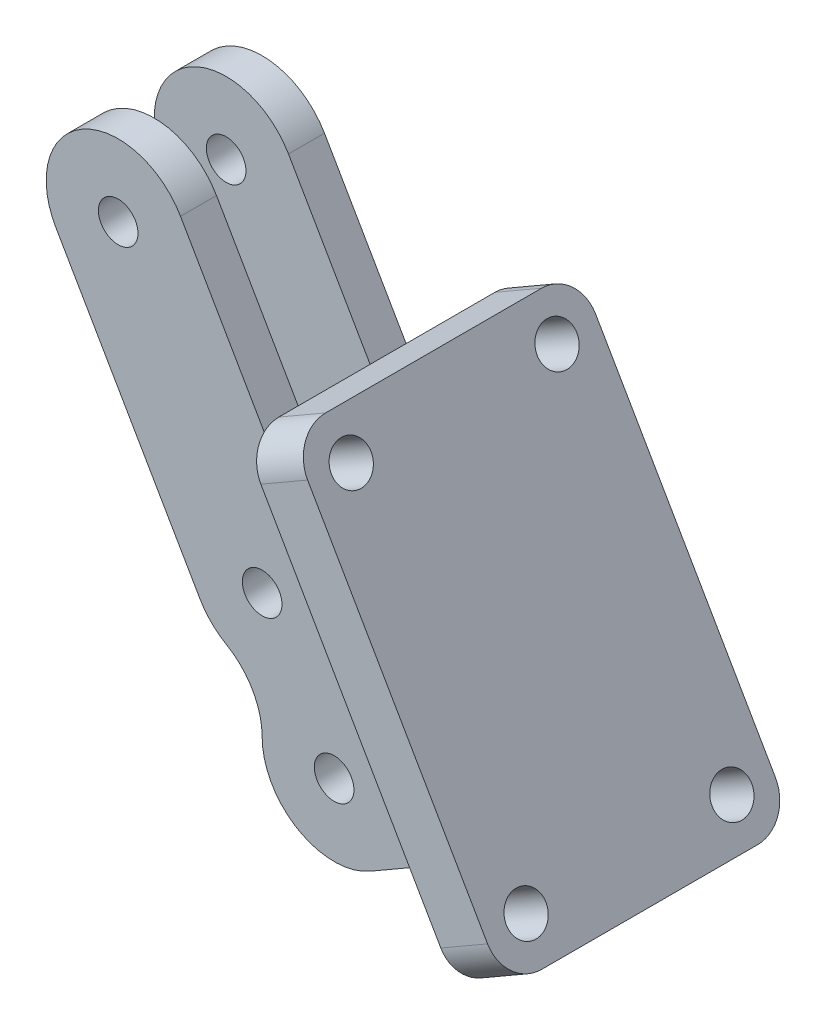
from build123d import *

# Parameters (mm, degrees)
SKETCH7_R               = 2.75
BOSS_EXTRUDE5_DEPTH     = 5
FILLET4_R               = 10
SKETCH8_R               = 2.75
BOSS_EXTRUDE6_DEPTH     = 5
SKETCH9_W               = 10
SKETCH9_H               = 10
SKETCH9_H_2             = 40
SKETCH9_W_2             = 5
BOSS_EXTRUDE7_DEPTH     = 7.5
FILLET5_R               = 5
SKETCH10_R              = 2.75
CUT_EXTRUDE3_DEPTH      = 64.495460213
SKETCH11_R              = 2.75
BOSS_EXTRUDE8_DEPTH     = 5
BOSS_EXTRUDE9_DEPTH     = 5
FILLET6_R               = 5
CUT_EXTRUDE4_START      = -5
SKETCH13_R              = 2.75
CUT_EXTRUDE4_DEPTH      = 5
CUT_EXTRUDE5_DEPTH      = 127.477470595
CUT_EXTRUDE5_DEPTH_BACK = 127.477470595
SKETCH14_R              = 2.75


with BuildPart() as part:
    # Sketch7 → Boss-Extrude5 (new body)
    with BuildSketch(Plane.XY):
        with BuildLine():
            Line((72.320508076, 39.737205584), (55, 29.737205584))
            ThreePointArc((55, 29.737205584), (51.339745962, 16.076951546), (65, 12.416697508))
            ThreePointArc((65, 12.416697508), (61.339745962, -1.24355653), (75, -4.903810568))
            Line((75, -4.903810568), (92.320508076, 5.096189432))
            Line((92.320508076, 5.096189432), (72.320508076, 39.737205584))
        make_face()
        with Locations((70, 3.75644347)):
            Circle(SKETCH7_R, mode=Mode.SUBTRACT)
        with Locations((60, 21.076951546)):
            Circle(SKETCH7_R, mode=Mode.SUBTRACT)
    extrude(amount=BOSS_EXTRUDE5_DEPTH)

    # Fillet4
    fillet4_edges = [part.edges().sort_by_distance(p)[0] for p in [
        (65, 12.416697508, 2.5),
    ]]
    fillet(fillet4_edges, radius=FILLET4_R)



with BuildPart() as body_2:
    # Sketch8 → Boss-Extrude6 (new body)
    with BuildSketch(Plane(origin=(0, 0, -10), x_dir=(-1, 0, 0), z_dir=(0, 0, -1))):
        with BuildLine():
            Line((-55, 29.737205584), (-72.320508076, 39.737205584))
            Line((-72.320508076, 39.737205584), (-92.320508076, 5.096189432))
            Line((-92.320508076, 5.096189432), (-75, -4.903810568))
            ThreePointArc((-75, -4.903810568), (-65, -4.903810568), (-60, 3.75644347))
            ThreePointArc((-60, 3.75644347), (-58.660254038, 8.75644347), (-55, 12.416697508))
            ThreePointArc((-55, 12.416697508), (-50, 21.076951546), (-55, 29.737205584))
        make_face()
        with Locations(Location((-70, 3.75644347, 0), (0, 0, 180))):
            Circle(SKETCH8_R, mode=Mode.SUBTRACT)
        with Locations(Location((-60, 21.076951546, 0), (0, 0, 180))):
            Circle(SKETCH8_R, mode=Mode.SUBTRACT)
    extrude(amount=BOSS_EXTRUDE6_DEPTH)


with BuildPart() as part_1:
    add(part.part)

    add(body_2.part)  # Boss-Extrude7 merges body 2
    # Sketch9 → Boss-Extrude7 (add)
    with BuildSketch(Plane(origin=(71.447095812, 41.25, 0), x_dir=(0, 0, -1), z_dir=(0.8660254037844416, 0.4999999999999949, 0))):
        with Locations((5, 3.253175473)):
            Rectangle(SKETCH9_W, SKETCH9_H)
        Polygon((0, 8.253175473), (-15, 8.253175473), (-15, -51.746824527), (25, -51.746824527), (25, 8.253175473), (10, 8.253175473), (10, -1.746824527), (15, -1.746824527), (15, -41.746824527), (10, -41.746824527), (0, -41.746824527), (-5, -41.746824527), (-5, -1.746824527), (0, -1.746824527), align=None)
        with Locations((5, -21.746824527)):
            Rectangle(SKETCH9_W, SKETCH9_H_2)
        with Locations((12.5, -21.746824527)):
            Rectangle(SKETCH9_W_2, SKETCH9_H_2)
        with Locations((-2.5, -21.746824527)):
            Rectangle(SKETCH9_W_2, SKETCH9_H_2)
    extrude(amount=BOSS_EXTRUDE7_DEPTH)

    # Fillet5
    fillet5_edges = [part_1.edges().sort_by_distance(p)[0] for p in [
        (70.56810334, 50.272459622, -25),
        (70.56810334, 50.272459622, 15),
        (100.56810334, -1.689064606, 15),
        (100.56810334, -1.689064606, -25),
    ]]
    fillet(fillet5_edges, radius=FILLET5_R)

    # Sketch10 → Cut-Extrude3 (cut, through all)
    with BuildSketch(Plane(origin=(77.942286341, 45, 0), x_dir=(0, 0, -1), z_dir=(0.8660254037844415, 0.4999999999999951, 0))):
        with Locations(Location((-9.292893219, 2.546068692, 0), (0, 0, 90))):
            Circle(SKETCH10_R)
        with Locations(Location((19.292893219, 2.546068692, 0), (0, 0, 90))):
            Circle(SKETCH10_R)
        with Locations(Location((19.292893219, -46.039717746, 0), (0, 0, 90))):
            Circle(SKETCH10_R)
        with Locations(Location((-9.292893219, -46.039717746, 0), (0, 0, 90))):
            Circle(SKETCH10_R)
    extrude(amount=-CUT_EXTRUDE3_DEPTH, mode=Mode.SUBTRACT)

    # Sketch11 → Boss-Extrude8 (add)
    with BuildSketch(Plane.XY):
        with BuildLine():
            Line((48.660254038, 60.717967697), (68.660254038, 26.076951546))
            ThreePointArc((68.660254038, 26.076951546), (65, 12.416697508), (51.339745962, 16.076951546))
            Line((51.339745962, 16.076951546), (31.339745962, 50.717967697))
            ThreePointArc((31.339745962, 50.717967697), (35, 64.378221735), (48.660254038, 60.717967697))
        make_face()
        with Locations((40, 55.717967697)):
            Circle(SKETCH11_R, mode=Mode.SUBTRACT)
        with Locations((60, 21.076951546)):
            Circle(SKETCH11_R, mode=Mode.SUBTRACT)
    extrude(amount=BOSS_EXTRUDE8_DEPTH)

    # Sketch12 → Boss-Extrude9 (add)
    with BuildSketch(Plane(origin=(0, 0, -10), x_dir=(-1, 0, 0), z_dir=(0, 0, -1))):
        with BuildLine():
            Line((-48.660254038, 60.717967697), (-63.660254038, 34.737205584))
            Line((-63.660254038, 34.737205584), (-72.320508076, 39.737205584))
            Line((-72.320508076, 39.737205584), (-92.320508076, 5.096189432))
            Line((-92.320508076, 5.096189432), (-75, -4.903810568))
            ThreePointArc((-75, -4.903810568), (-65, -4.903810568), (-60, 3.75644347))
            ThreePointArc((-60, 3.75644347), (-58.660254038, 8.75644347), (-55, 12.416697508))
            ThreePointArc((-55, 12.416697508), (-52.928932188, 14.005883734), (-51.339745962, 16.076951546))
            Line((-51.339745962, 16.076951546), (-31.339745962, 50.717967697))
            ThreePointArc((-31.339745962, 50.717967697), (-35, 64.378221735), (-48.660254038, 60.717967697))
        make_face()
    extrude(amount=BOSS_EXTRUDE9_DEPTH)

    # Fillet6
    fillet6_edges = [part_1.edges().sort_by_distance(p)[0] for p in [
        (92.320508076, 5.096189432, -12.5),
        (92.320508076, 5.096189432, 2.5),
        (72.320508076, 39.737205584, -12.5),
        (72.320508076, 39.737205584, 2.5),
        (63.660254038, 34.737205584, -12.5),
        (63.660254038, 34.737205584, 2.5),
    ]]
    fillet(fillet6_edges, radius=FILLET6_R - 0.0001)  # a hair under: the kernel refuses the full size

    # Sketch13 → Cut-Extrude4 (cut)
    with BuildSketch(Plane.XY.offset(-10).offset(CUT_EXTRUDE4_START)):
        with Locations((40, 55.717967697)):
            Circle(SKETCH13_R)
    extrude(amount=CUT_EXTRUDE4_DEPTH, mode=Mode.SUBTRACT)

    # Sketch14 → Cut-Extrude5 (cut, two sides: drawn at the far end of the back side and taken through both)
    with BuildSketch(Plane.XY.offset(5).offset(-CUT_EXTRUDE5_DEPTH_BACK)):
        with Locations((60, 21.076951546)):
            Circle(SKETCH14_R)
        with Locations((70, 3.75644347)):
            Circle(SKETCH14_R)
    extrude(amount=CUT_EXTRUDE5_DEPTH + CUT_EXTRUDE5_DEPTH_BACK, mode=Mode.SUBTRACT)


solid = part_1.part
